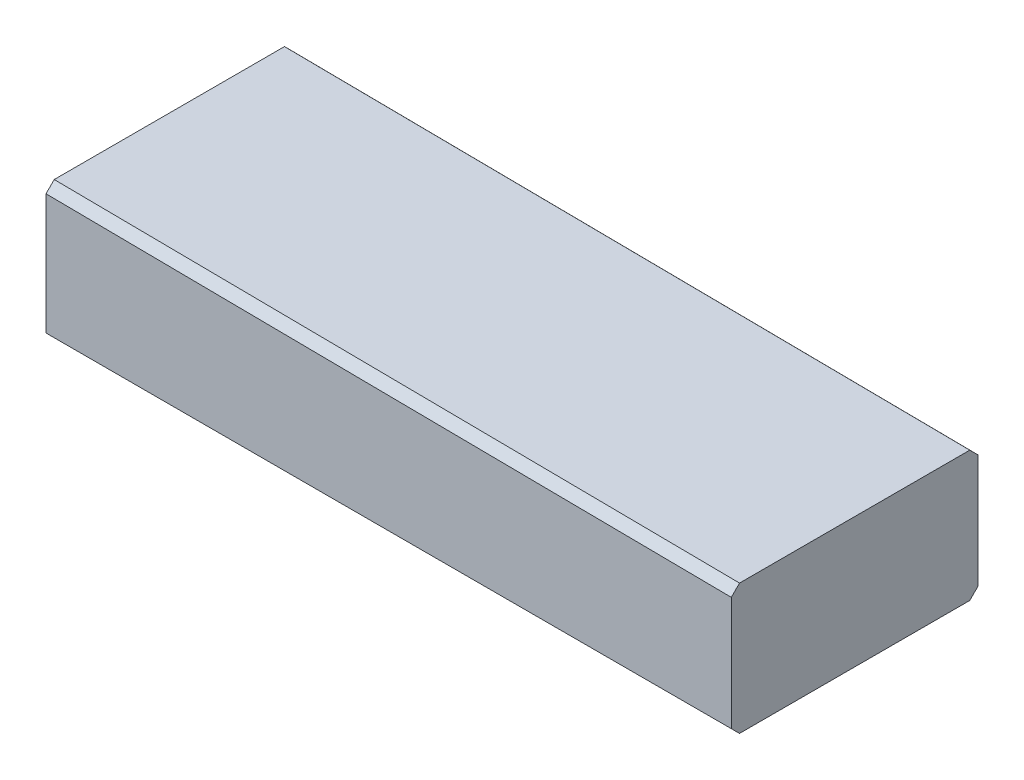
from build123d import *

# Parameters (mm, degrees)
BASEBODY_DEPTH = 36
CHAMFER1_SIZE  = 1.2


with BuildPart() as part:
    # BodySke → BaseBody (new body)
    with BuildSketch(Plane.XY):
        Polygon((0, 0), (0, 20), (100, 19), (100, 0), align=None)
    extrude(amount=BASEBODY_DEPTH)

    # Chamfer1
    chamfer1_edges = [part.edges().sort_by_distance(p)[0] for p in [
        (50, 19.5, 0),
        (50, 0, 0),
        (50, 0, 36),
        (50, 19.5, 36),
    ]]
    chamfer(chamfer1_edges, length=CHAMFER1_SIZE)


solid = part.part
